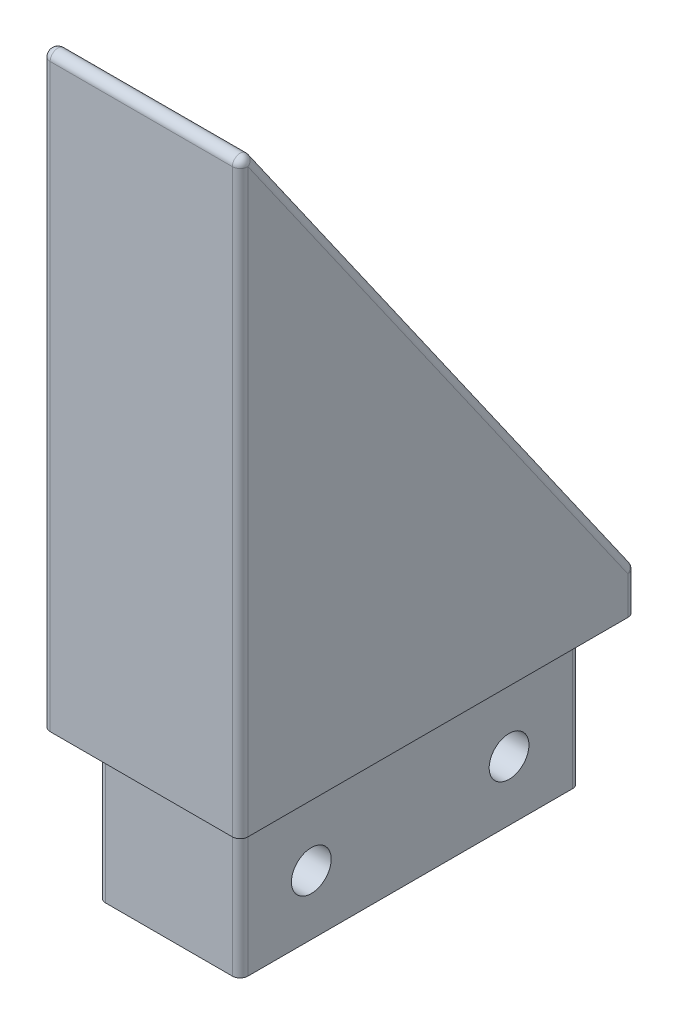
from build123d import *

# Parameters (mm, degrees)
BOSS_EXTRUDE1_DEPTH = 12.7
SKETCH2_W           = 18.288
SKETCH2_H           = 43.688
BOSS_EXTRUDE2_DEPTH = 19.05
FILLET1_R           = 1
SKETCH3_R           = 2.5527
CUT_EXTRUDE1_DEPTH  = 94.626739061


with BuildPart() as part:
    # Sketch1 → Boss-Extrude1 (new, symmetric)
    with BuildSketch(Plane(origin=(0, 0, 0), x_dir=(0, 0, -1), z_dir=(1, 0, 0))):
        Polygon((0, 0), (0, 77.724), (50.8, 5.174081258), (50.8, 0), align=None)
    extrude(amount=BOSS_EXTRUDE1_DEPTH, both=True)

    # Sketch2 → Boss-Extrude2 (add)
    with BuildSketch(Plane.XZ):
        with Locations((0, -25.4)):
            Rectangle(SKETCH2_W, SKETCH2_H)
    extrude(amount=BOSS_EXTRUDE2_DEPTH)

    # Fillet1
    fillet1_edges = [part.edges().sort_by_distance(p)[0] for p in [
        (12.7, 41.449040629, -25.4),
        (-12.7, 41.449040629, -25.4),
        (9.144, -9.525, -3.556),
        (-9.144, -9.525, -47.244),
        (9.144, -9.525, -47.244),
        (-12.7, 38.862, 0),
        (12.7, 38.862, 0),
        (12.7, 2.587040629, -50.8),
        (-12.7, 2.587040629, -50.8),
        (-9.144, -9.525, -3.556),
        (0, 5.174081258, -50.8),
        (0, 77.724, 0),
    ]]
    fillet(fillet1_edges, radius=FILLET1_R)

    # Sketch3 → Cut-Extrude1 (cut, through all)
    with BuildSketch(Plane(origin=(9.144, 0, 0), x_dir=(0, 0, -1), z_dir=(1, 0, 0))):
        with Locations((38.1, -11.375365521)):
            Circle(SKETCH3_R)
        with Locations((12.7, -11.375365521)):
            Circle(SKETCH3_R)
    extrude(amount=-CUT_EXTRUDE1_DEPTH, mode=Mode.SUBTRACT)


solid = part.part
